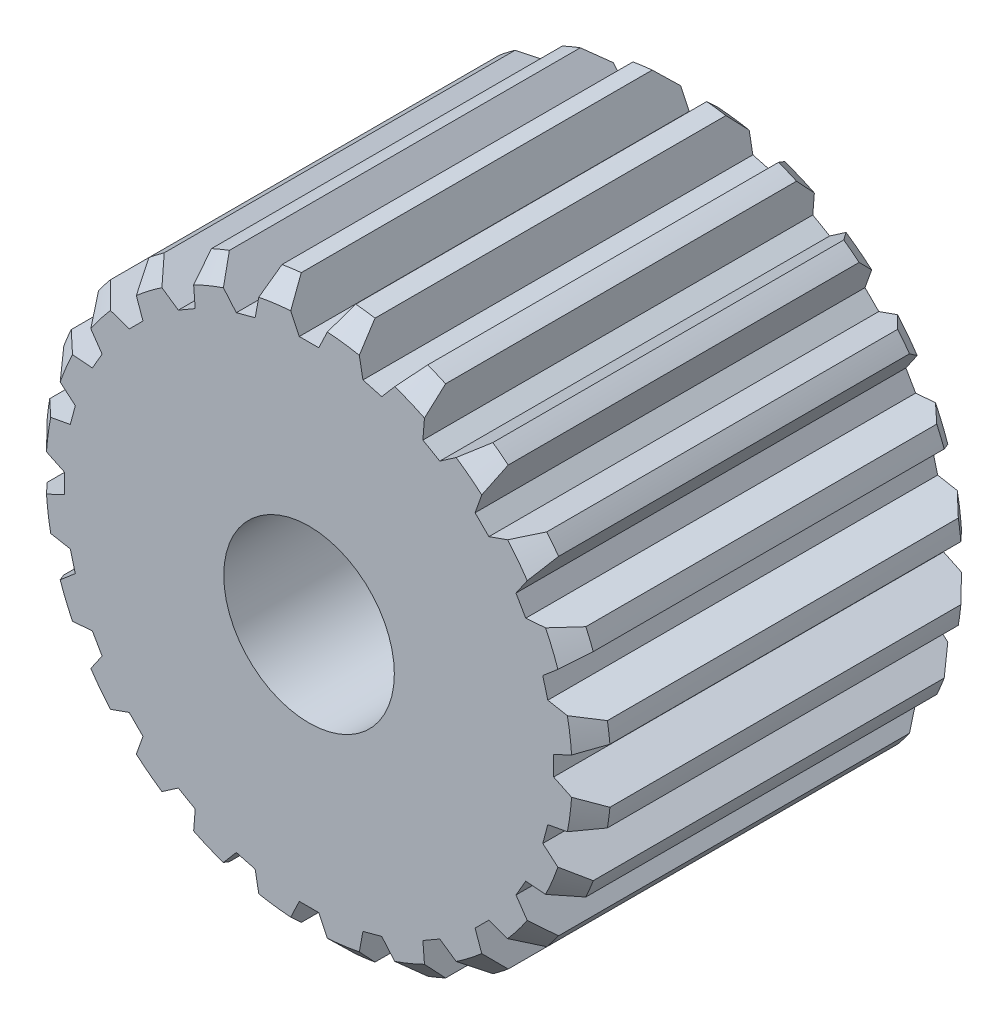
from build123d import *

# Parameters (mm, degrees)
SKETCH_1_R               = 2.9
EXTRUDE_1_DEPTH          = 4
CHAMFER_1_SIZE           = 0.2
CUT_EXTRUDE_1_DEPTH      = 6.728874235
PATTERN_CIRCULAR_1_DEPTH = 4
M2_2X0_45_2_D            = 1.75
M2_2X0_45_2_DEPTH        = 5.75
M2_2X0_45_2_TIP          = 0.525753042


# Read off the part's stored shape, not the designer's step: 阵列(圆周)1
with BuildPart() as part:
    # 草图1 → 凸台-拉伸1 (new body)
    with BuildSketch(Plane.XY):
        Circle(SKETCH_1_R)
    extrude(amount=EXTRUDE_1_DEPTH)

    # 倒角1
    chamfer_1_edges = [part.edges().sort_by_distance(p)[0] for p in [
        (-2.9, 0, 0),
        (-2.9, 0, 4),
    ]]
    chamfer(chamfer_1_edges, length=CHAMFER_1_SIZE)

    # 草图2 → 切除-拉伸1 (cut, through all)
    with BuildSketch(Plane(origin=(0, 0, 0), x_dir=(-1, 0, 0), z_dir=(0, 0, -1))):
        Polygon((-0.3, 2.928815094), (0.3, 2.928815094), (0.1, 2.509087078), (-0.1, 2.509087078), align=None)
    extrude(amount=-CUT_EXTRUDE_1_DEPTH, mode=Mode.SUBTRACT)

    # 阵列(圆周)1 outline → 阵列(圆周)1 (cut)
    with BuildSketch(Plane.XY):
        with BuildLine():
            Line((0.552806939, 2.449473914), (0.745992104, 2.397710104))
            Line((0.745992104, 2.397710104), (1.017360127, 2.715691141))
            ThreePointArc((1.017360127, 2.715691141), (0.750575231, 2.801184897), (0.476785855, 2.860537581))
            Line((0.476785855, 2.860537581), (0.552806939, 2.449473914))
        make_face()
        with BuildLine():
            ThreePointArc((-0.476785855, 2.860537581), (-0.750575231, 2.801184897), (-1.017360127, 2.715691141))
            Line((-1.017360127, 2.715691141), (-0.745992104, 2.397710104))
            Line((-0.745992104, 2.397710104), (-0.552806939, 2.449473914))
            Line((-0.552806939, 2.449473914), (-0.476785855, 2.860537581))
        make_face()
        with BuildLine():
            ThreePointArc((-1.200901376, 2.639665866), (-1.45, 2.511473671), (-1.685567009, 2.359844033))
            Line((-1.685567009, 2.359844033), (-1.341146079, 2.12293315))
            Line((-1.341146079, 2.12293315), (-1.167940999, 2.22293315))
            Line((-1.167940999, 2.22293315), (-1.200901376, 2.639665866))
        make_face()
        with BuildLine():
            ThreePointArc((-1.843177453, 2.238905285), (-2.050609666, 2.050609666), (-2.238905285, 1.843177453))
            Line((-2.238905285, 1.843177453), (-1.844903166, 1.703481809))
            Line((-1.844903166, 1.703481809), (-1.703481809, 1.844903166))
            Line((-1.703481809, 1.844903166), (-1.843177453, 2.238905285))
        make_face()
        with BuildLine():
            ThreePointArc((-2.359844033, 1.685567009), (-2.511473671, 1.45), (-2.639665866, 1.200901376))
            Line((-2.639665866, 1.200901376), (-2.22293315, 1.167940999))
            Line((-2.22293315, 1.167940999), (-2.12293315, 1.341146079))
            Line((-2.12293315, 1.341146079), (-2.359844033, 1.685567009))
        make_face()
        with BuildLine():
            ThreePointArc((-2.715691141, 1.017360127), (-2.801184897, 0.750575231), (-2.860537581, 0.476785855))
            Line((-2.860537581, 0.476785855), (-2.449473914, 0.552806939))
            Line((-2.449473914, 0.552806939), (-2.397710104, 0.745992104))
            Line((-2.397710104, 0.745992104), (-2.715691141, 1.017360127))
        make_face()
        with BuildLine():
            ThreePointArc((-2.886468386, 0.279821834), (-2.9, 0), (-2.886468386, -0.279821834))
            Line((-2.886468386, -0.279821834), (-2.509087078, -0.1))
            Line((-2.509087078, -0.1), (-2.509087078, 0.1))
            Line((-2.509087078, 0.1), (-2.886468386, 0.279821834))
        make_face()
        with BuildLine():
            ThreePointArc((-2.86053758, -0.476785855), (-2.801184896, -0.750575231), (-2.715691141, -1.017360127))
            Line((-2.715691141, -1.017360127), (-2.397710104, -0.745992104))
            Line((-2.397710104, -0.745992104), (-2.449473914, -0.552806939))
            Line((-2.449473914, -0.552806939), (-2.86053758, -0.476785855))
        make_face()
        with BuildLine():
            ThreePointArc((-2.639665866, -1.200901376), (-2.511473671, -1.45), (-2.359844032, -1.685567009))
            Line((-2.359844032, -1.685567009), (-2.12293315, -1.341146079))
            Line((-2.12293315, -1.341146079), (-2.22293315, -1.167940999))
            Line((-2.22293315, -1.167940999), (-2.639665866, -1.200901376))
        make_face()
        with BuildLine():
            ThreePointArc((-2.238905285, -1.843177453), (-2.050609665, -2.050609665), (-1.843177453, -2.238905285))
            Line((-1.843177453, -2.238905285), (-1.703481809, -1.844903166))
            Line((-1.703481809, -1.844903166), (-1.844903166, -1.703481809))
            Line((-1.844903166, -1.703481809), (-2.238905285, -1.843177453))
        make_face()
        with BuildLine():
            ThreePointArc((-1.685567009, -2.359844032), (-1.45, -2.511473671), (-1.200901376, -2.639665866))
            Line((-1.200901376, -2.639665866), (-1.167940999, -2.22293315))
            Line((-1.167940999, -2.22293315), (-1.341146079, -2.12293315))
            Line((-1.341146079, -2.12293315), (-1.685567009, -2.359844032))
        make_face()
        with BuildLine():
            ThreePointArc((-1.017360127, -2.715691141), (-0.75057523, -2.801184896), (-0.476785855, -2.86053758))
            Line((-0.476785855, -2.86053758), (-0.552806939, -2.449473914))
            Line((-0.552806939, -2.449473914), (-0.745992104, -2.397710104))
            Line((-0.745992104, -2.397710104), (-1.017360127, -2.715691141))
        make_face()
        with BuildLine():
            ThreePointArc((-0.279821834, -2.886468386), (0, -2.9), (0.279821834, -2.886468386))
            Line((0.279821834, -2.886468386), (0.1, -2.509087078))
            Line((0.1, -2.509087078), (-0.1, -2.509087078))
            Line((-0.1, -2.509087078), (-0.279821834, -2.886468386))
        make_face()
        with BuildLine():
            ThreePointArc((0.476785855, -2.86053758), (0.75057523, -2.801184896), (1.017360127, -2.715691141))
            Line((1.017360127, -2.715691141), (0.745992104, -2.397710104))
            Line((0.745992104, -2.397710104), (0.552806939, -2.449473914))
            Line((0.552806939, -2.449473914), (0.476785855, -2.86053758))
        make_face()
        with BuildLine():
            ThreePointArc((1.200901376, -2.639665866), (1.45, -2.511473671), (1.685567009, -2.359844032))
            Line((1.685567009, -2.359844032), (1.341146079, -2.12293315))
            Line((1.341146079, -2.12293315), (1.167940999, -2.22293315))
            Line((1.167940999, -2.22293315), (1.200901376, -2.639665866))
        make_face()
        with BuildLine():
            ThreePointArc((1.843177453, -2.238905285), (2.050609665, -2.050609665), (2.238905285, -1.843177453))
            Line((2.238905285, -1.843177453), (1.844903166, -1.703481809))
            Line((1.844903166, -1.703481809), (1.703481809, -1.844903166))
            Line((1.703481809, -1.844903166), (1.843177453, -2.238905285))
        make_face()
        with BuildLine():
            ThreePointArc((2.359844032, -1.685567009), (2.511473671, -1.45), (2.639665866, -1.200901376))
            Line((2.639665866, -1.200901376), (2.22293315, -1.167940999))
            Line((2.22293315, -1.167940999), (2.12293315, -1.341146079))
            Line((2.12293315, -1.341146079), (2.359844032, -1.685567009))
        make_face()
        with BuildLine():
            ThreePointArc((2.715691141, -1.017360127), (2.801184896, -0.750575231), (2.86053758, -0.476785855))
            Line((2.86053758, -0.476785855), (2.449473914, -0.552806939))
            Line((2.449473914, -0.552806939), (2.397710104, -0.745992104))
            Line((2.397710104, -0.745992104), (2.715691141, -1.017360127))
        make_face()
        with BuildLine():
            ThreePointArc((2.886468386, -0.279821834), (2.9, 0), (2.886468386, 0.279821834))
            Line((2.886468386, 0.279821834), (2.509087078, 0.1))
            Line((2.509087078, 0.1), (2.509087078, -0.1))
            Line((2.509087078, -0.1), (2.886468386, -0.279821834))
        make_face()
        with BuildLine():
            ThreePointArc((2.860537581, 0.476785855), (2.801184897, 0.750575231), (2.715691141, 1.017360127))
            Line((2.715691141, 1.017360127), (2.397710104, 0.745992104))
            Line((2.397710104, 0.745992104), (2.449473914, 0.552806939))
            Line((2.449473914, 0.552806939), (2.860537581, 0.476785855))
        make_face()
        with BuildLine():
            ThreePointArc((2.639665866, 1.200901376), (2.511473671, 1.45), (2.359844033, 1.685567009))
            Line((2.359844033, 1.685567009), (2.12293315, 1.341146079))
            Line((2.12293315, 1.341146079), (2.22293315, 1.167940999))
            Line((2.22293315, 1.167940999), (2.639665866, 1.200901376))
        make_face()
        with BuildLine():
            ThreePointArc((2.238905285, 1.843177453), (2.050609666, 2.050609666), (1.843177453, 2.238905285))
            Line((1.843177453, 2.238905285), (1.703481809, 1.844903166))
            Line((1.703481809, 1.844903166), (1.844903166, 1.703481809))
            Line((1.844903166, 1.703481809), (2.238905285, 1.843177453))
        make_face()
        with BuildLine():
            ThreePointArc((1.685567009, 2.359844033), (1.45, 2.511473671), (1.200901376, 2.639665866))
            Line((1.200901376, 2.639665866), (1.167940999, 2.22293315))
            Line((1.167940999, 2.22293315), (1.341146079, 2.12293315))
            Line((1.341146079, 2.12293315), (1.685567009, 2.359844033))
        make_face()
    extrude(amount=PATTERN_CIRCULAR_1_DEPTH, mode=Mode.SUBTRACT)

    # M2.2x0.45 螺纹孔2
    with Locations(Plane(origin=(0, 0, 0), x_dir=(-1, 0, 0), z_dir=(0, 0, -1))):
        with Locations((0, 0)):
            Hole(M2_2X0_45_2_D / 2, depth=M2_2X0_45_2_DEPTH)
            with Locations((0, 0, -(M2_2X0_45_2_DEPTH + M2_2X0_45_2_TIP / 2))):  # 118° drill point
                Cone(0, M2_2X0_45_2_D / 2, M2_2X0_45_2_TIP, mode=Mode.SUBTRACT)


solid = part.part
